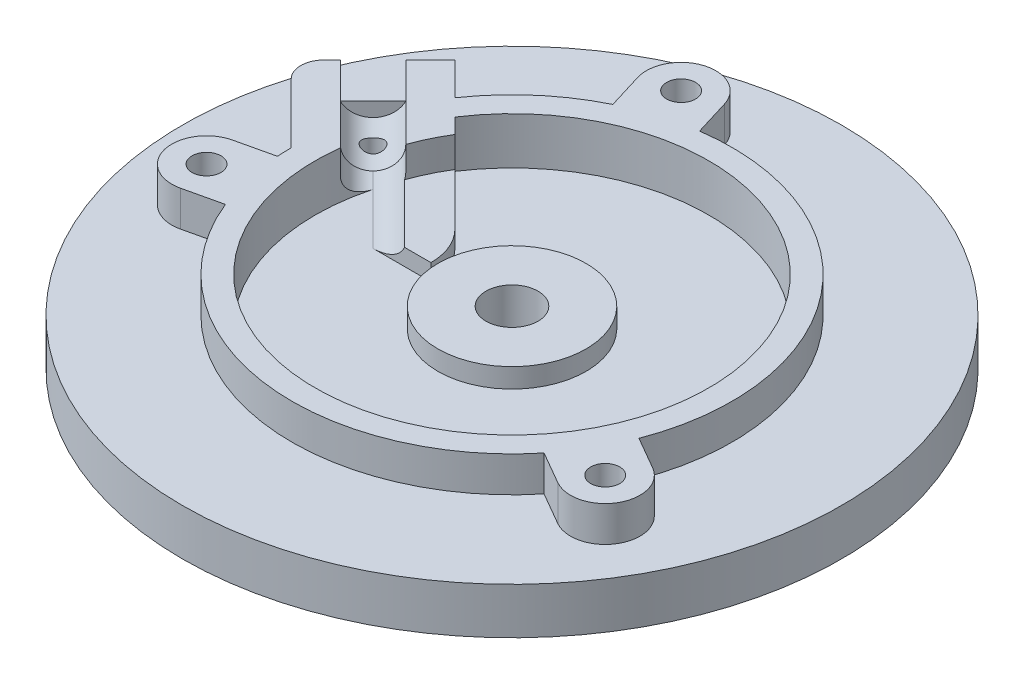
from build123d import *

# Parameters (mm, degrees)
SKETCH1_R          = 30.1625
SKETCH1_R_2        = 3.571875
EXTRUDE1_DEPTH     = 4.7625
EXTRUDE2_START     = 2.286
SKETCH2_R          = 30.1625
SKETCH2_R_2        = 26.9875
EXTRUDE2_DEPTH     = 2.286
EXTRUDE3_START     = 2.286
EXTRUDE3_DEPTH     = 2.286
CUT_EXTRUDE1_START = -2.286
CUT_EXTRUDE1_DEPTH = 2.286
EXTRUDE4_START     = 4.16052
EXTRUDE4_DEPTH     = 4.16052
EXTRUDE6_START     = -4.7625
EXTRUDE6_DEPTH     = 4.7625
EXTRUDE7_START     = 6.44652
EXTRUDE7_DEPTH     = 6.44652
FILLET1_R          = 3.175
EXTRUDE8_START     = -4.7625
EXTRUDE8_OUTLINE_R = 1.984375
EXTRUDE8_DEPTH     = 11.20902
EXTRUDE8_START_2   = -36.000693059
EXTRUDE8_2_DEPTH   = 9.525
EXTRUDE9_START     = 2.667
SKETCH11_R         = 10.16
SKETCH11_R_2       = 3.571875
EXTRUDE9_DEPTH     = 2.667
SPLIT1_START       = -4.7625
SPLIT1_OUTLINE_R   = 1.35255
SPLIT1_DEPTH       = 11.20902
EXTRUDE10_START    = -6.35
SKETCH13_R         = 45.1866
EXTRUDE10_DEPTH    = 6.35


# Read off the part's stored shape, not the designer's step: Extrude8, Split1
with BuildPart() as part:
    # Sketch1 → Extrude1 (new body)
    with BuildSketch(Plane(origin=(0, 0, 0), x_dir=(1, 0, 0), z_dir=(0, 1, 0))):
        with Locations(Location((0, 0, 0), (0, 0, 270))):
            Circle(SKETCH1_R)
        with Locations(Location((0, 0, 0), (0, 0, 270))):
            Circle(SKETCH1_R_2, mode=Mode.SUBTRACT)
    extrude(amount=-EXTRUDE1_DEPTH)

    # Sketch2 → Extrude2 (add)
    with BuildSketch(Plane(origin=(0, 0, 0), x_dir=(-1, 0, 0), z_dir=(0, 1, 0)).offset(EXTRUDE2_START)):
        with Locations(Location((0, 0, 0), (0, 0, 90))):
            Circle(SKETCH2_R)
        with Locations(Location((0, 0, 0), (0, 0, 90))):
            Circle(SKETCH2_R_2, mode=Mode.SUBTRACT)
    extrude(amount=-EXTRUDE2_DEPTH)

    # Sketch3 → Extrude3 (add)
    with BuildSketch(Plane(origin=(0, 0, 0), x_dir=(-1, 0, 0), z_dir=(0, 1, 0)).offset(EXTRUDE3_START)):
        with BuildLine():
            Line((24.919808713, -10.359936774), (14.559871939, 0))
            Line((14.559871939, 0), (11.1125, 0))
            ThreePointArc((11.1125, 0), (11.716706211, -3.037549744), (13.437339924, -5.612660076))
            Line((13.437339924, -5.612660076), (22.590031817, -14.765351968))
            ThreePointArc((22.590031817, -14.765351968), (23.856826226, -12.616536715), (24.919808713, -10.359936774))
        make_face()
    extrude(amount=-EXTRUDE3_DEPTH)

    # Sketch4 → Cut-Extrude1 (cut)
    with BuildSketch(Plane(origin=(0, 2.286, 0), x_dir=(-1, 0, 0), z_dir=(0, 1, 0)).offset(CUT_EXTRUDE1_START)):
        with BuildLine():
            Line((27.327148629, -12.767276689), (24.919808713, -10.359936774))
            ThreePointArc((24.919808713, -10.359936774), (26.098589577, -6.86940888), (26.790988464, -3.250860404))
            Line((26.790988464, -3.250860404), (29.556401367, -6.016273306))
            ThreePointArc((29.556401367, -6.016273306), (28.64137875, -9.457686268), (27.327148629, -12.767276689))
        make_face()
    extrude(amount=CUT_EXTRUDE1_DEPTH, mode=Mode.SUBTRACT)

    # Sketch5 → Extrude4 (add)
    with BuildSketch(Plane(origin=(0, 2.286, 0), x_dir=(-1, 0, 0), z_dir=(0, 1, 0)).offset(EXTRUDE4_START)):
        with BuildLine():
            ThreePointArc((29.556401367, -6.016273306), (-28.64137875, 9.457686268), (27.327148629, -12.767276689))
            Line((27.327148629, -12.767276689), (22.711429166, -8.151557227))
            ThreePointArc((22.711429166, -8.151557227), (21.734904661, -10.480974162), (20.52023101, -12.695551161))
            Line((20.52023101, -12.695551161), (22.590031817, -14.765351968))
            ThreePointArc((22.590031817, -14.765351968), (-25.352853291, 9.24975601), (26.790988464, -3.250860404))
            Line((26.790988464, -3.250860404), (29.556401367, -6.016273306))
        make_face()
    extrude(amount=-EXTRUDE4_DEPTH)

    # Sketch7 → Extrude6 (add)
    with BuildSketch(Plane.XZ.offset(4.7625).offset(EXTRUDE6_START)):
        with BuildLine():
            Line((-29.368674114, -21.543994265), (-24.878546053, -17.053866205))
            ThreePointArc((-24.878546053, -17.053866205), (-28.827919749, -8.872848988), (-30.162288209, 0.113031942))
            Line((-30.162288209, 0.113031942), (-40.593994265, -10.318674114))
            Line((-40.593994265, -10.318674114), (-29.368674114, -21.543994265))
        make_face()
    extrude(amount=EXTRUDE6_DEPTH)

    # Sketch8 → Extrude7 (add)
    with BuildSketch(Plane(origin=(0, 0, 0), x_dir=(-1, 0, 0), z_dir=(0, 1, 0)).offset(EXTRUDE7_START)):
        with BuildLine():
            Line((27.327148629, -12.767276689), (32.736270159, -18.17639822))
            Line((32.736270159, -18.17639822), (29.368674114, -21.543994265))
            Line((29.368674114, -21.543994265), (24.878546053, -17.053866205))
            ThreePointArc((24.878546053, -17.053866205), (26.190692082, -14.960750466), (27.327148629, -12.767276689))
        make_face()
        with BuildLine():
            Line((29.556401367, -6.016273306), (37.22639822, -13.686270159))
            Line((37.22639822, -13.686270159), (40.593994265, -10.318674114))
            Line((40.593994265, -10.318674114), (30.162288209, 0.113031942))
            ThreePointArc((30.162288209, 0.113031942), (30.016205071, -2.96712645), (29.556401367, -6.016273306))
        make_face()
    extrude(amount=-EXTRUDE7_DEPTH)

    # Fillet1
    # the kernel refuses this fillet: 3.175 mm, written as the material it adds along each edge
    with BuildSketch(Plane(origin=(-32.736270159, 0, -18.17639822), x_dir=(-0.7071067811865481, 0, 0.707106781186547), z_dir=(0.707106781186547, 0, 0.707106781186548))) as fillet1_piece_1_section:
        with BuildLine():
            CenterArc((FILLET1_R, -FILLET1_R), FILLET1_R, 90, 90)
            Line((0, -FILLET1_R), (0, 0))
            Line((0, 0), (FILLET1_R, 0))
        make_face()
    fillet1_piece_1 = extrude(amount=33.642808877, mode=Mode.PRIVATE)
    fillet1_piece_1 = split(fillet1_piece_1, bisect_by=Plane(origin=(-28.125346977, 2.286, -12.485884273), z_dir=(0, -1, 0)), keep=Keep.TOP, mode=Mode.PRIVATE)
    fillet1_piece_1 = fillet1_piece_1 - Plane(origin=(0, 0.637531041, 0), x_dir=(-0.9412113206103934, 0, -0.33781836829106776), z_dir=(0, 1, 0)) * Cylinder(24.13, 80, mode=Mode.PRIVATE)
    add(fillet1_piece_1)
    with BuildSketch(Plane(origin=(-32.736270159, 0, -18.17639822), x_dir=(-0.7071067811865481, 0, 0.707106781186547), z_dir=(0.707106781186547, 0, 0.707106781186548))) as fillet1_piece_2_section:
        with BuildLine():
            CenterArc((FILLET1_R, -FILLET1_R), FILLET1_R, 90, 90)
            Line((0, -FILLET1_R), (0, 0))
            Line((0, 0), (FILLET1_R, 0))
        make_face()
    fillet1_piece_2 = extrude(amount=33.642808877, mode=Mode.PRIVATE)
    fillet1_piece_2 = split(fillet1_piece_2, bisect_by=Plane(origin=(-27.721701516, 2.286, -13.167406565), z_dir=(0, 1, 0)), keep=Keep.TOP, mode=Mode.PRIVATE)
    fillet1_piece_2 = fillet1_piece_2 - Plane(origin=(0, 2.641516211, 0), x_dir=(-0.9412113206103934, 0, -0.33781836829106776), z_dir=(0, 1, 0)) * Cylinder(24.13, 80, mode=Mode.PRIVATE)
    add(fillet1_piece_2)
    with BuildSketch(Plane(origin=(-32.736270159, 0, -18.17639822), x_dir=(-0.7071067811865481, 0, 0.707106781186547), z_dir=(0.707106781186547, 0, 0.707106781186548))) as fillet1_piece_3_section:
        with BuildLine():
            CenterArc((FILLET1_R, -FILLET1_R), FILLET1_R, 90, 90)
            Line((0, -FILLET1_R), (0, 0))
            Line((0, 0), (FILLET1_R, 0))
        make_face()
    fillet1_piece_3 = extrude(amount=33.642808877, mode=Mode.PRIVATE)
    fillet1_piece_3 = split(fillet1_piece_3, bisect_by=Plane(origin=(-19.232138403, 0.68020426, 0), z_dir=(0, 0, -1)), keep=Keep.TOP, mode=Mode.PRIVATE)
    fillet1_piece_3 = split(fillet1_piece_3, bisect_by=Plane(origin=(-19.232138403, 2.286, -3.714419145), z_dir=(0, -1, 0)), keep=Keep.TOP, mode=Mode.PRIVATE)
    fillet1_piece_3 = fillet1_piece_3 & Plane(origin=(0, 0.68020426, 0), x_dir=(-0.9412113206103934, 0, -0.33781836829106776), z_dir=(0, 1, 0)) * Cylinder(24.13, 80, mode=Mode.PRIVATE)
    add(fillet1_piece_3)
    with BuildSketch(Plane(origin=(-21.178328388, 0, 2.361799672), x_dir=(0.7071067811865476, 0, -0.7071067811865474), z_dir=(-0.7071067811865474, 0, -0.7071067811865477))) as fillet1_piece_4_section:
        with BuildLine():
            CenterArc((FILLET1_R, -FILLET1_R), FILLET1_R, 90, 90)
            Line((0, -FILLET1_R), (0, 0))
            Line((0, 0), (FILLET1_R, 0))
        make_face()
    fillet1_piece_4 = extrude(amount=22.695398005, mode=Mode.PRIVATE)
    fillet1_piece_4 = fillet1_piece_4 - Plane(origin=(0, 0.732754622, 0), x_dir=(0, 0, 1), z_dir=(0, 1, 0)) * Cylinder(26.9875, 59, mode=Mode.PRIVATE)
    add(fillet1_piece_4)

    # Extrude8 outline → Extrude8 (add)
    # profile 1 of 3: a face of its own
    with BuildSketch(Plane(origin=(0, 0, 0), x_dir=(1, 0, 0), z_dir=(0, 1, 0)).offset(EXTRUDE8_START)):
        with BuildLine():
            ThreePointArc((-13.262441208, 27.090294562), (-8.818661544, 28.844542202), (-4.153638407, 29.87513505))
            Line((-4.153638407, 29.87513505), (-5.656680387, 34.791363846))
            ThreePointArc((-5.656680387, 34.791363846), (-11.603502031, 37.953345002), (-14.765483188, 32.006523358))
            Line((-14.765483188, 32.006523358), (-13.262441208, 27.090294562))
        make_face()
        with Locations((-10.211081787, 33.398943602)):
            Circle(EXTRUDE8_OUTLINE_R, mode=Mode.SUBTRACT)
    # profile 2 of 3: a face of its own
    with BuildSketch(Plane(origin=(0, 0, 0), x_dir=(1, 0, 0), z_dir=(0, 1, 0)).offset(EXTRUDE8_START)):
        with BuildLine():
            Line((-32.958545116, -12.496853006), (-27.949445097, -11.340411146))
            ThreePointArc((-27.949445097, -11.340411146), (-29.389437079, -6.785086176), (-30.09210389, -2.059536279))
            Line((-30.09210389, -2.059536279), (-35.101203909, -3.215978139))
            ThreePointArc((-35.101203909, -3.215978139), (-38.670311946, -8.927744969), (-32.958545116, -12.496853006))
        make_face()
        with Locations((-34.029874513, -7.856415573)):
            Circle(EXTRUDE8_OUTLINE_R, mode=Mode.SUBTRACT)
    # profile 3 of 3: a face of its own
    with BuildSketch(Plane(origin=(0, 0, 0), x_dir=(1, 0, 0), z_dir=(0, 1, 0)).offset(EXTRUDE8_START)):
        with BuildLine():
            Line((32.627187227, -13.338054014), (28.175071934, -10.767624052))
            ThreePointArc((28.175071934, -10.767624052), (26.121491241, -15.08125), (23.412571934, -19.016516022))
            Line((23.412571934, -19.016516022), (27.864687227, -21.586945986))
            ThreePointArc((27.864687227, -21.586945986), (34.370383213, -19.84375), (32.627187227, -13.338054014))
        make_face()
        with Locations((30.245937227, -17.4625)):
            Circle(EXTRUDE8_OUTLINE_R, mode=Mode.SUBTRACT)
    extrude(amount=EXTRUDE8_DEPTH)

    # Extrude8 2 outline → Extrude8 2 (cut)
    with BuildSketch(Plane(origin=(0, 0, 0), x_dir=(0.7071067811865474, 0, -0.7071067811865477), z_dir=(0.7071067811865476, 0, 0.7071067811865476)).offset(EXTRUDE8_START_2)):
        with BuildLine():
            ThreePointArc((-16.645384182, 4.811357545), (-13.470384182, -0.396875), (-10.295384182, 4.811357545))
            Line((-10.295384182, 4.811357545), (-10.295384182, 3.175))
            ThreePointArc((-10.295384182, 3.175), (-11.225320152, 0.92993597), (-13.470384182, 0))
            ThreePointArc((-13.470384182, 0), (-15.715448212, 0.92993597), (-16.645384182, 3.175))
            Line((-16.645384182, 3.175), (-16.645384182, 4.811357545))
        make_face()
    extrude(amount=EXTRUDE8_2_DEPTH, mode=Mode.SUBTRACT)

    # Sketch11 → Extrude9 (add)
    with BuildSketch(Plane(origin=(0, 0, 0), x_dir=(-1, 0, 0), z_dir=(0, 1, 0)).offset(EXTRUDE9_START)):
        with Locations(Location((0, 0, 0), (0, 0, 90))):
            Circle(SKETCH11_R)
        with Locations(Location((0, 0, 0), (0, 0, 90))):
            Circle(SKETCH11_R_2, mode=Mode.SUBTRACT)
    extrude(amount=-EXTRUDE9_DEPTH)

    # Split1 outline → Split1 (cut)
    with BuildSketch(Plane(origin=(0, 0, 0), x_dir=(1, 0, 0), z_dir=(0, 1, 0)).offset(SPLIT1_START)):
        with Locations((-31.613738144, 12.563738144)):
            Circle(SPLIT1_OUTLINE_R)
        with BuildLine():
            Line((-40.593994265, 10.318674114), (-38.348930235, 8.073610084))
            ThreePointArc((-38.348930235, 8.073610084), (-39.278866205, 10.318674114), (-38.348930235, 12.563738144))
            Line((-38.348930235, 12.563738144), (-40.593994265, 10.318674114))
        make_face()
    extrude(amount=SPLIT1_DEPTH, mode=Mode.SUBTRACT)

    # Split1 2 outline → Split1 2 (revolve, cut)
    with BuildSketch(Plane(origin=(30.245937227, 0, 17.4625), x_dir=(1, 0, 0), z_dir=(0, 0, 1))):
        Polygon((3.571875, -4.7625), (1.984375, -3.175), (1.984375, -4.7625), align=None)
    revolve(axis=Axis((30.245937227, 0, 17.4625), (0, 1, 0)), mode=Mode.SUBTRACT)

    # Split1 3 outline → Split1 3 (revolve, cut)
    with BuildSketch(Plane(origin=(-10.211081787, 0, -33.398943602), x_dir=(1, 0, 0), z_dir=(0, 0, 1))):
        Polygon((3.571875, -4.7625), (1.984375, -3.175), (1.984375, -4.7625), align=None)
    revolve(axis=Axis((-10.211081787, 0, -33.398943602), (0, 1, 0)), mode=Mode.SUBTRACT)

    # Split1 4 outline → Split1 4 (revolve, cut)
    with BuildSketch(Plane(origin=(-34.029874513, 0, 7.856415573), x_dir=(1, 0, 0), z_dir=(0, 0, 1))):
        Polygon((3.571875, -4.7625), (1.984375, -3.175), (1.984375, -4.7625), align=None)
    revolve(axis=Axis((-34.029874513, 0, 7.856415573), (0, 1, 0)), mode=Mode.SUBTRACT)

    # Sketch13 → Extrude10 (add)
    with BuildSketch(Plane.XZ.offset(4.7625).offset(EXTRUDE10_START)):
        with Locations(Location((0, 0, 0), (0, 0, 270))):
            Circle(SKETCH13_R)
        with BuildLine():
            Line((-30.162288209, 0.113031942), (-38.348930235, -8.073610084))
            ThreePointArc((-38.348930235, -8.073610084), (-39.278866205, -10.318674114), (-38.348930235, -12.563738144))
            Line((-38.348930235, -12.563738144), (-29.368674114, -21.543994265))
            Line((-29.368674114, -21.543994265), (-24.878546053, -17.053866205))
            ThreePointArc((-24.878546053, -17.053866205), (-19.719690689, -22.82345735), (-13.262441208, -27.090294562))
            Line((-13.262441208, -27.090294562), (-14.765483188, -32.006523358))
            ThreePointArc((-14.765483188, -32.006523358), (-11.603502031, -37.953345002), (-5.656680387, -34.791363846))
            Line((-5.656680387, -34.791363846), (-4.153638407, -29.87513505))
            ThreePointArc((-4.153638407, -29.87513505), (23.605418531, -18.776597728), (28.175071935, 10.767624052))
            Line((28.175071935, 10.767624052), (32.627187227, 13.338054014))
            ThreePointArc((32.627187227, 13.338054014), (34.370383213, 19.84375), (27.864687227, 21.586945986))
            Line((27.864687227, 21.586945986), (23.412571935, 19.016516023))
            ThreePointArc((23.412571935, 19.016516023), (-4.458301363, 29.831190979), (-27.949445098, 11.340411146))
            Line((-27.949445098, 11.340411146), (-32.958545116, 12.496853006))
            ThreePointArc((-32.958545116, 12.496853006), (-38.670311946, 8.927744969), (-35.101203909, 3.215978139))
            Line((-35.101203909, 3.215978139), (-30.092103891, 2.059536279))
            ThreePointArc((-30.092103891, 2.059536279), (-30.142912295, 1.086850785), (-30.162288209, 0.113031942))
        make_face(mode=Mode.SUBTRACT)
    extrude(amount=EXTRUDE10_DEPTH)


solid = part.part
